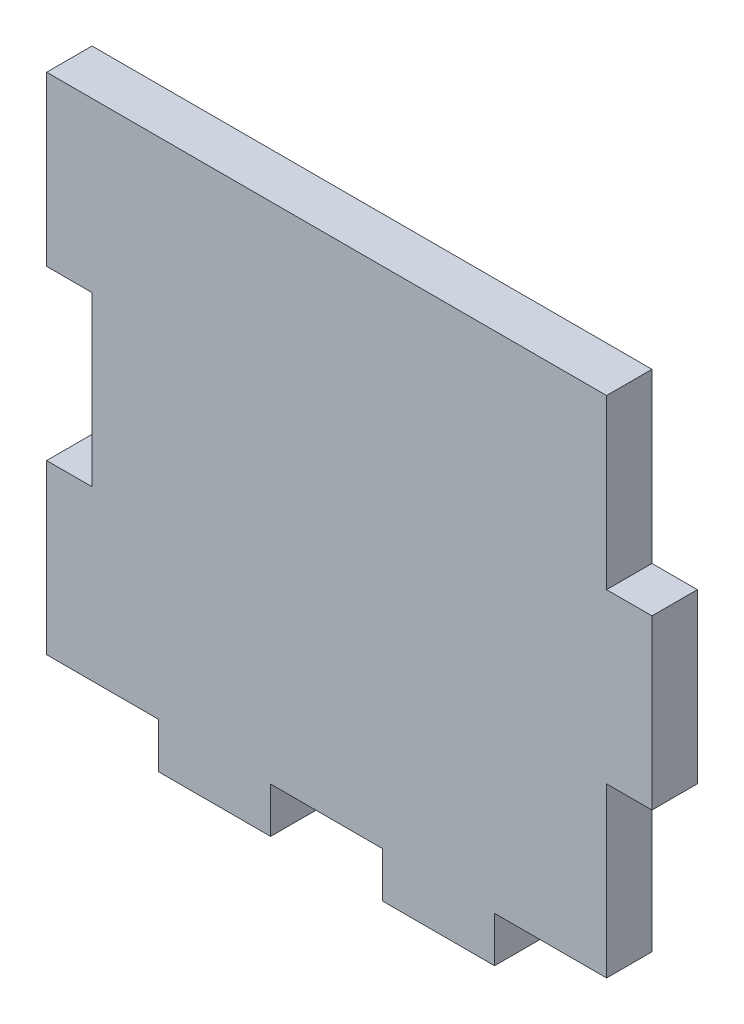
from build123d import *

# Parameters (mm, degrees)
BOSS_EXTRUDE1_DEPTH = 4.5


with BuildPart() as part:
    # Sketch1 → Boss-Extrude1 (new body)
    with BuildSketch(Plane.XY):
        Polygon((22.2, 0), (33.3, 0), (33.3, -4.5), (44.4, -4.5), (44.4, 0), (55.5, 0), (55.5, 16.666666667), (60, 16.666666667), (60, 33.333333333), (55.5, 33.333333333), (55.5, 50), (40, 50), (20, 50), (0, 50), (0, 33.333333333), (4.5, 33.333333333), (4.5, 16.666666667), (0, 16.666666667), (0, 0), (11.1, 0), (11.1, -4.5), (22.2, -4.5), align=None)
    extrude(amount=BOSS_EXTRUDE1_DEPTH)


solid = part.part
